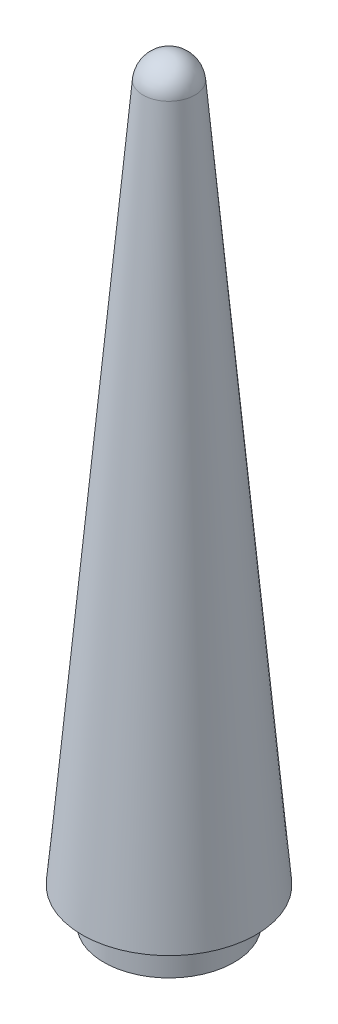
from build123d import *

# Parameters (mm, degrees)
F_1_4_20_TAPPED_HOLE1_D           = 5.1054
F_1_4_20_TAPPED_HOLE1_DEPTH       = 63.5
F_1_4_20_TAPPED_HOLE1_CSINK_D     = 7.62
F_1_4_20_TAPPED_HOLE1_CSINK_ANGLE = 90
F_1_4_20_TAPPED_HOLE1_TIP         = 1.533816902


with BuildPart() as part:
    # Sketch2 → Revolve1 (revolve)
    with BuildSketch(Plane.XY):
        with BuildLine():
            Line((0, 101.668343504), (0, -3.727096769))
            Line((0, -3.727096769), (0, -8.807096769))
            Line((0, -8.807096769), (9.525, -8.807096769))
            Line((9.525, -8.807096769), (9.525, -3.727096769))
            Line((9.525, -3.727096769), (12.712127984, -3.727096769))
            Line((12.712127984, -3.727096769), (3.7955018, 98.190406884))
            ThreePointArc((3.7955018, 98.190406884), (2.573998691, 100.667370157), (0, 101.668343504))
        make_face()
    revolve(axis=Axis((0, -3.727096769, 0), (0, 1, 0)))

    # 1/4-20 Tapped Hole1
    with Locations(Plane.XZ.offset(8.807096769)):
        with Locations((0, 0)):
            CounterSinkHole(F_1_4_20_TAPPED_HOLE1_D / 2, F_1_4_20_TAPPED_HOLE1_CSINK_D / 2, depth=F_1_4_20_TAPPED_HOLE1_DEPTH, counter_sink_angle=F_1_4_20_TAPPED_HOLE1_CSINK_ANGLE)
            with Locations((0, 0, -(F_1_4_20_TAPPED_HOLE1_DEPTH + F_1_4_20_TAPPED_HOLE1_TIP / 2))):  # 118° drill point
                Cone(0, F_1_4_20_TAPPED_HOLE1_D / 2, F_1_4_20_TAPPED_HOLE1_TIP, mode=Mode.SUBTRACT)


solid = part.part
